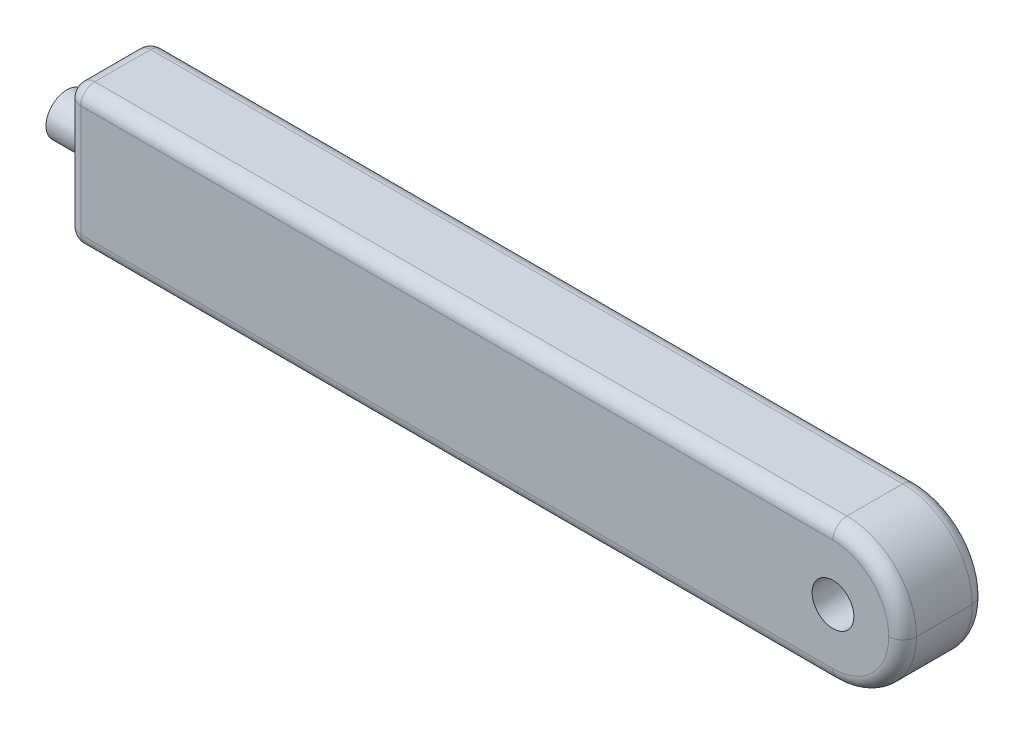
from build123d import *

# Parameters (mm, degrees)
CROQUIS1_W              = 300
CROQUIS1_H              = 50
CROQUIS1_R              = 7.5
SALIENTE_EXTRUIR1_DEPTH = 30
REDONDEO1_R             = 25
CROQUIS2_R              = 7.5
SALIENTE_EXTRUIR2_DEPTH = 15
REDONDEO2_R             = 5


with BuildPart() as part:
    # Croquis1 → Saliente-Extruir1 (new body)
    with BuildSketch(Plane.XY):
        with Locations((150, 25)):
            Rectangle(CROQUIS1_W, CROQUIS1_H)
        with Locations((275, 25)):
            Circle(CROQUIS1_R, mode=Mode.SUBTRACT)
    extrude(amount=SALIENTE_EXTRUIR1_DEPTH)

    # Redondeo1
    redondeo1_edges = [part.edges().sort_by_distance(p)[0] for p in [
        (300, 0, 15),
        (300, 50, 15),
    ]]
    fillet(redondeo1_edges, radius=REDONDEO1_R - 0.0001)  # a hair under: the kernel refuses the full size

    # Croquis2 → Saliente-Extruir2 (add)
    with BuildSketch(Plane.ZY):
        with Locations((15, 25)):
            Circle(CROQUIS2_R)
    extrude(amount=SALIENTE_EXTRUIR2_DEPTH)

    # Redondeo2
    redondeo2_edges = [part.edges().sort_by_distance(p)[0] for p in [
        (137.50005, 50, 0),
        (292.677698819, 42.677698819, 0),
        (292.677698819, 7.322301181, 0),
        (137.50005, 50, 30),
        (292.677698819, 42.677698819, 30),
        (292.677698819, 7.322301181, 30),
        (0, 25, 30),
        (137.50005, 0, 0),
        (0, 25, 0),
        (137.50005, 0, 30),
        (0, 50, 15),
        (0, 0, 15),
    ]]
    fillet(redondeo2_edges, radius=REDONDEO2_R)


solid = part.part
